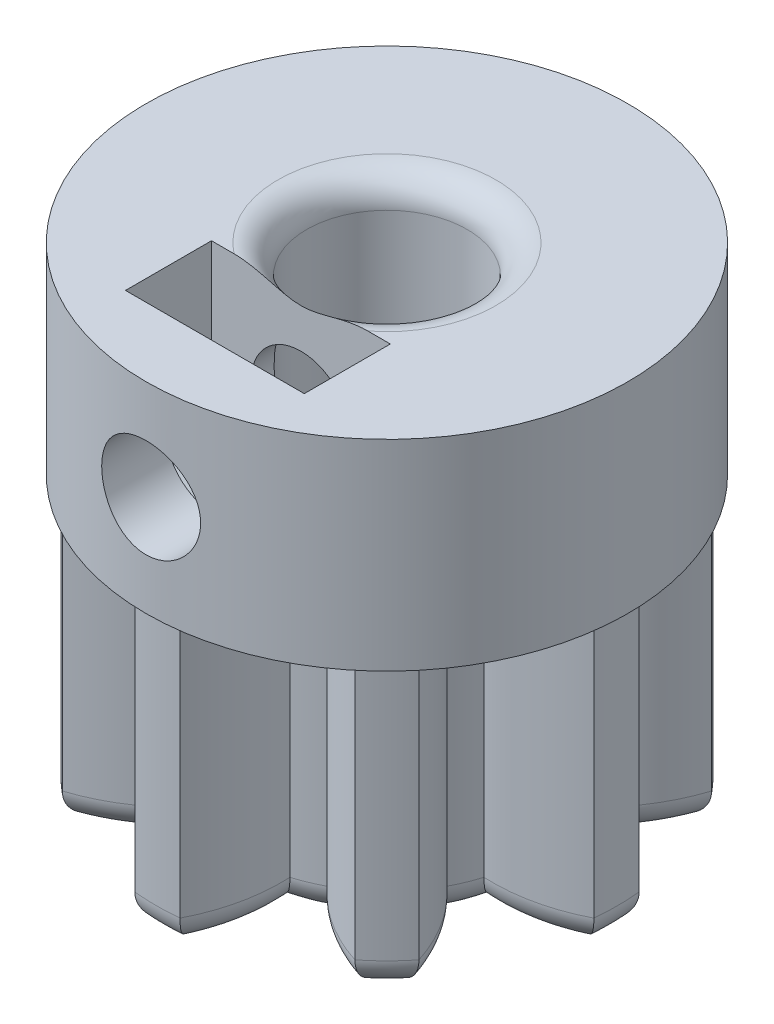
from build123d import *

# Parameters (mm, degrees)
CROQUIS1_R              = 8.4
SALIENTE_EXTRUIR1_DEPTH = 17
CROQUIS1_3_R            = 2.8
CORTAR_EXTRUIR5_DEPTH   = 17
CROQUIS1_4_R            = 8.4
CORTAR_EXTRUIR6_DEPTH   = 10
CROQUIS2_R              = 1.725
CORTAR_EXTRUIR7_DEPTH   = 10
CORTAR_EXTRUIR8_DEPTH   = 3
REDONDEO1_R             = 1
REDONDEO2_R             = 1


with BuildPart() as part:
    # Croquis1 → Saliente-Extruir1 (new body)
    with BuildSketch(Plane(origin=(0, 0, 0), x_dir=(1, 0, 0), z_dir=(0, 1, 0))):
        with Locations(Location((0, 0, 0), (0, 0, 270))):
            Circle(CROQUIS1_R)
    extrude(amount=SALIENTE_EXTRUIR1_DEPTH)

    # Croquis1<3> → Cortar-Extruir5 (cut)
    with BuildSketch(Plane(origin=(0, 0, 0), x_dir=(1, 0, 0), z_dir=(0, 1, 0))):
        with Locations(Location((0, 0, 0), (0, 0, 270))):
            Circle(CROQUIS1_3_R)
    extrude(amount=CORTAR_EXTRUIR5_DEPTH, mode=Mode.SUBTRACT)

    # Croquis1<4> → Cortar-Extruir6 (cut)
    with BuildSketch(Plane(origin=(0, 0, 0), x_dir=(1, 0, 0), z_dir=(0, 1, 0))):
        with Locations(Location((0, 0, 0), (0, 0, 270))):
            Circle(CROQUIS1_4_R)
        with BuildLine():
            ThreePointArc((-4.475750417, 2.392338439), (-4.688688627, 1.942118419), (-4.856472204, 1.473194737))
            ThreePointArc((-4.856472204, 1.473194737), (-6.475773471, 1.338922496), (-8.004519553, 0.788376364))
            ThreePointArc((-8.004519553, 0.788376364), (-8.04325, 0), (-8.004519553, -0.788376364))
            ThreePointArc((-8.004519553, -0.788376364), (-6.475773471, -1.338922496), (-4.856472204, -1.473194737))
            ThreePointArc((-4.856472204, -1.473194737), (-4.688688627, -1.942118419), (-4.475750417, -2.392338439))
            ThreePointArc((-4.475750417, -2.392338439), (-5.525824511, -3.632302158), (-6.217516329, -5.102583783))
            ThreePointArc((-6.217516329, -5.102583783), (-5.687436618, -5.687436618), (-5.102583783, -6.217516329))
            ThreePointArc((-5.102583783, -6.217516329), (-3.632302158, -5.525824511), (-2.392338439, -4.475750417))
            ThreePointArc((-2.392338439, -4.475750417), (-1.942118419, -4.688688627), (-1.473194737, -4.856472204))
            ThreePointArc((-1.473194737, -4.856472204), (-1.338922496, -6.475773471), (-0.788376364, -8.004519553))
            ThreePointArc((-0.788376364, -8.004519553), (0, -8.04325), (0.788376364, -8.004519553))
            ThreePointArc((0.788376364, -8.004519553), (1.338922496, -6.475773471), (1.473194737, -4.856472204))
            ThreePointArc((1.473194737, -4.856472204), (1.942118419, -4.688688627), (2.392338439, -4.475750417))
            ThreePointArc((2.392338439, -4.475750417), (3.632302158, -5.525824511), (5.102583783, -6.217516329))
            ThreePointArc((5.102583783, -6.217516329), (5.687436618, -5.687436618), (6.217516329, -5.102583783))
            ThreePointArc((6.217516329, -5.102583783), (5.525824511, -3.632302158), (4.475750417, -2.392338439))
            ThreePointArc((4.475750417, -2.392338439), (4.688688627, -1.942118419), (4.856472204, -1.473194737))
            ThreePointArc((4.856472204, -1.473194737), (6.475773471, -1.338922496), (8.004519553, -0.788376364))
            ThreePointArc((8.004519553, -0.788376364), (8.04325, 0), (8.004519553, 0.788376364))
            ThreePointArc((8.004519553, 0.788376364), (6.475773471, 1.338922496), (4.856472204, 1.473194737))
            ThreePointArc((4.856472204, 1.473194737), (4.688688627, 1.942118419), (4.475750417, 2.392338439))
            ThreePointArc((4.475750417, 2.392338439), (5.525824511, 3.632302158), (6.217516329, 5.102583783))
            ThreePointArc((6.217516329, 5.102583783), (5.687436618, 5.687436618), (5.102583783, 6.217516329))
            ThreePointArc((5.102583783, 6.217516329), (3.632302158, 5.525824511), (2.392338439, 4.475750417))
            ThreePointArc((2.392338439, 4.475750417), (1.942118419, 4.688688627), (1.473194737, 4.856472204))
            ThreePointArc((1.473194737, 4.856472204), (1.338922496, 6.475773471), (0.788376364, 8.004519553))
            ThreePointArc((0.788376364, 8.004519553), (0, 8.04325), (-0.788376364, 8.004519553))
            ThreePointArc((-0.788376364, 8.004519553), (-1.338922496, 6.475773471), (-1.473194737, 4.856472204))
            ThreePointArc((-1.473194737, 4.856472204), (-1.942118419, 4.688688627), (-2.392338439, 4.475750417))
            ThreePointArc((-2.392338439, 4.475750417), (-3.632302158, 5.525824511), (-5.102583783, 6.217516329))
            ThreePointArc((-5.102583783, 6.217516329), (-5.687436618, 5.687436618), (-6.217516329, 5.102583783))
            ThreePointArc((-6.217516329, 5.102583783), (-5.525824511, 3.632302158), (-4.475750417, 2.392338439))
        make_face(mode=Mode.SUBTRACT)
    extrude(amount=CORTAR_EXTRUIR6_DEPTH, mode=Mode.SUBTRACT)

    # Croquis2 → Cortar-Extruir7 (cut)
    with BuildSketch(Plane.XY):
        with Locations(Location((0, 13.5, 0), (0, 0, 180))):
            Circle(CROQUIS2_R)
    extrude(amount=CORTAR_EXTRUIR7_DEPTH, mode=Mode.SUBTRACT)

    # Croquis3 → Cortar-Extruir8 (cut)
    with BuildSketch(Plane.XY.offset(3)):
        Polygon((3.117691454, 17), (-3.117691454, 17), (-3.117691454, 11.7), (0, 9.9), (3.117691454, 11.7), align=None)
    extrude(amount=CORTAR_EXTRUIR8_DEPTH, mode=Mode.SUBTRACT)

    # Redondeo1
    redondeo1_edges = [part.edges().sort_by_distance(p)[0] for p in [
        (-4.688688627, 0, -1.942118419),
        (-6.475773471, 0, -1.338922496),
        (-8.04325, 0, 0),
        (-6.475773471, 0, 1.338922496),
        (-4.688688627, 0, 1.942118419),
        (-5.525824511, 0, 3.632302158),
        (-5.687436618, 0, 5.687436618),
        (-3.632302158, 0, 5.525824511),
        (-1.942118419, 0, 4.688688627),
        (-1.338922496, 0, 6.475773471),
        (0, 0, 8.04325),
        (1.338922496, 0, 6.475773471),
        (1.942118419, 0, 4.688688627),
        (3.632302158, 0, 5.525824511),
        (5.687436618, 0, 5.687436618),
        (5.525824511, 0, 3.632302158),
        (4.688688627, 0, 1.942118419),
        (6.475773471, 0, 1.338922496),
        (8.04325, 0, 0),
        (6.475773471, 0, -1.338922496),
        (4.688688627, 0, -1.942118419),
        (5.525824511, 0, -3.632302158),
        (5.687436618, 0, -5.687436618),
        (3.632302158, 0, -5.525824511),
        (1.942118419, 0, -4.688688627),
        (1.338922496, 0, -6.475773471),
        (0, 0, -8.04325),
        (-1.338922496, 0, -6.475773471),
        (-1.942118419, 0, -4.688688627),
        (-3.632302158, 0, -5.525824511),
        (-5.687436618, 0, -5.687436618),
        (-5.525824511, 0, -3.632302158),
        (0, 0, -2.8),
    ]]
    fillet(redondeo1_edges, radius=REDONDEO1_R)

    # Redondeo2
    # the kernel refuses this fillet: 1 mm, written as the material it takes off along each edge
    with BuildSketch(Plane(origin=(0, 17, 0), x_dir=(0, 0, 1), z_dir=(-1, 0, 0))) as redondeo2_piece_1:
        with BuildLine():
            CenterArc((2.8 + REDONDEO2_R, -REDONDEO2_R), REDONDEO2_R, 90, 90)
            Line((2.8 + REDONDEO2_R, 0), (2.8, 0))
            Line((2.8, 0), (2.8, -REDONDEO2_R))
        make_face()
    revolve(axis=Axis((0, 17, 0), (0, 1, 0)), mode=Mode.SUBTRACT)


solid = part.part
